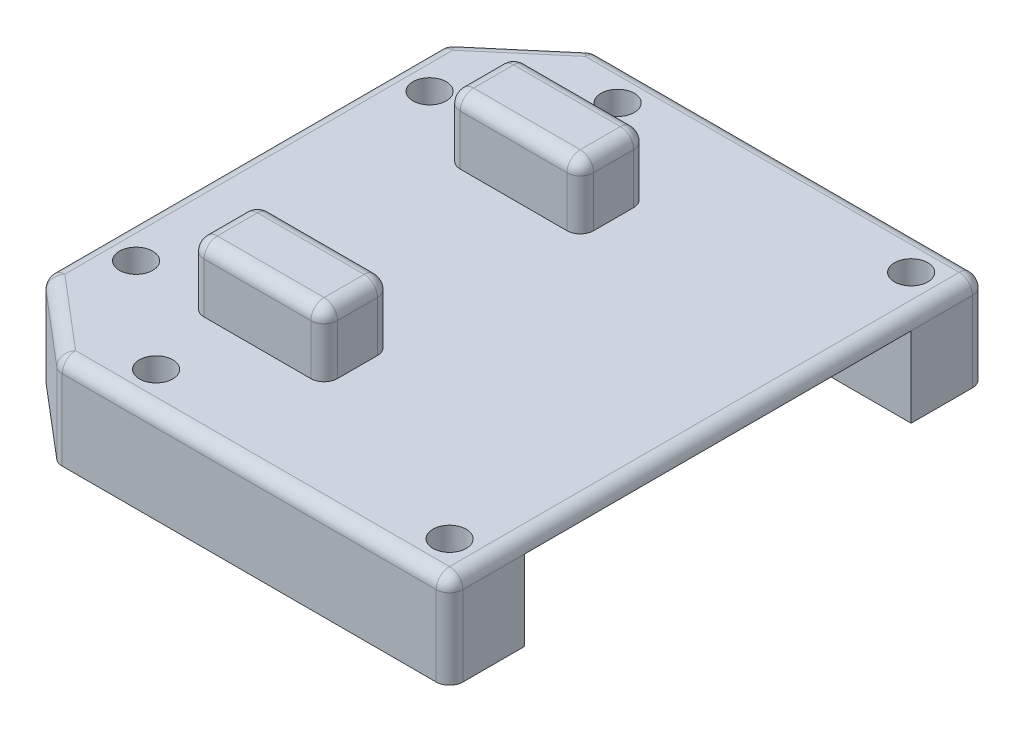
from build123d import *

# Parameters (mm, degrees)
SKETCH1_W           = 35.4
SKETCH1_H           = 40.2
BOSS_EXTRUDE1_DEPTH = 7
SKETCH2_W           = 29
SKETCH2_H           = 6
CUT_EXTRUDE1_DEPTH  = 29.8
SKETCH3_R           = 1.25
CUT_EXTRUDE2_DEPTH  = 28.682124196
SKETCH4_W           = 10
SKETCH4_H           = 5
BOSS_EXTRUDE2_DEPTH = 4.7625
CHAMFER1_SIZE       = 5.1
CHAMFER1_SIZE2      = 6
MIRROR4_START       = -26.778357323
MIRROR4_OUTLINE_W   = 11
MIRROR4_OUTLINE_H   = 9
MIRROR4_DEPTH       = 3.885890521
FILLET1_R           = 1


# Read off the part's stored shape, not the designer's step: Mirror4
with BuildPart() as part:
    # Sketch1 → Boss-Extrude1 (new body)
    with BuildSketch(Plane(origin=(0, 0, 0), x_dir=(1, 0, 0), z_dir=(0, 1, 0))):
        Rectangle(SKETCH1_W, SKETCH1_H)
    extrude(amount=BOSS_EXTRUDE1_DEPTH)

    # Sketch2 → Cut-Extrude1 (cut)
    with BuildSketch(Plane(origin=(17.7, 0, 0), x_dir=(0, 0, -1), z_dir=(1, 0, 0))):
        with Locations((0, 3)):
            Rectangle(SKETCH2_W, SKETCH2_H)
    extrude(amount=-CUT_EXTRUDE1_DEPTH, mode=Mode.SUBTRACT)

    # Sketch3 → Cut-Extrude2 (cut, through all)
    with BuildSketch(Plane(origin=(0, 7, 0), x_dir=(1, 0, 0), z_dir=(0, 1, 0))):
        with Locations(Location((14.9, 17.3, 0), (0, 0, 270))):
            Circle(SKETCH3_R)
        with Locations(Location((-7.1, 17.3, 0), (0, 0, 270))):
            Circle(SKETCH3_R)
        with Locations(Location((-14.9, 11, 0), (0, 0, 270))):
            Circle(SKETCH3_R)
    cut_extrude2 = extrude(amount=-CUT_EXTRUDE2_DEPTH, mode=Mode.SUBTRACT)

    # Sketch4 → Boss-Extrude2 (add)
    with BuildSketch(Plane(origin=(0, 7, 0), x_dir=(-1, 0, 0), z_dir=(0, 1, 0))):
        with Locations((4.7, -9.6)):
            Rectangle(SKETCH4_W, SKETCH4_H)
    boss_extrude2 = extrude(amount=BOSS_EXTRUDE2_DEPTH)

    # Mirror1: Cut-Extrude2, Boss-Extrude2 across plane
    add(cut_extrude2.mirror(Plane.XY), mode=Mode.SUBTRACT)
    add(boss_extrude2.mirror(Plane.XY))

    # Chamfer1
    chamfer1_edges = [part.edges().sort_by_distance(p)[0] for p in [
        (-17.7, 3.5, 20.1),
    ]]
    chamfer1_side = [part.faces().sort_by_distance(p)[0] for p in [
        (-17.7, 3.5, 0),
    ]]
    chamfer(chamfer1_edges, length=CHAMFER1_SIZE, length2=CHAMFER1_SIZE2, reference=chamfer1_side[0])

    # Mirror4 outline → Mirror4 (cut)
    with BuildSketch(Plane(origin=(0, 0, 0), x_dir=(0.7619393177594598, 0, -0.6476484200955399), z_dir=(0.6476484200955399, 0, 0.7619393177594598)).offset(MIRROR4_START)):
        with Locations((0.5, 3.5)):
            Rectangle(MIRROR4_OUTLINE_W, MIRROR4_OUTLINE_H)
    extrude(amount=MIRROR4_DEPTH, mode=Mode.SUBTRACT)

    # Fillet1
    fillet1_edges = [part.edges().sort_by_distance(p)[0] for p in [
        (17.7, 7, 0),
        (0.3, 9.38125, -7.1),
        (0.3, 9.38125, -12.1),
        (-9.7, 9.38125, -12.1),
        (-9.7, 9.38125, -7.1),
        (0.3, 11.7625, -9.6),
        (-4.7, 11.7625, -12.1),
        (-9.7, 11.7625, -9.6),
        (-4.7, 11.7625, -7.1),
        (0.3, 11.7625, 9.6),
        (0.3, 9.38125, 12.1),
        (-4.7, 11.7625, 7.1),
        (0.3, 9.38125, 7.1),
        (-9.7, 11.7625, 9.6),
        (-9.7, 9.38125, 7.1),
        (-4.7, 11.7625, 12.1),
        (-9.7, 9.38125, 12.1),
        (3, 7, -20.1),
        (17.7, 3.5, 20.1),
        (17.7, 3.5, -20.1),
        (3, 7, 20.1),
        (-11.7, 3.5, 20.1),
        (-17.7, 3.5, 15),
        (-14.7, 7, 17.55),
        (-17.7, 7, 0),
        (-11.7, 3.5, -20.1),
        (-17.7, 3.5, -15),
        (-14.7, 7, -17.55),
    ]]
    fillet(fillet1_edges, radius=FILLET1_R - 0.0001)  # a hair under: the kernel refuses the full size


solid = part.part
